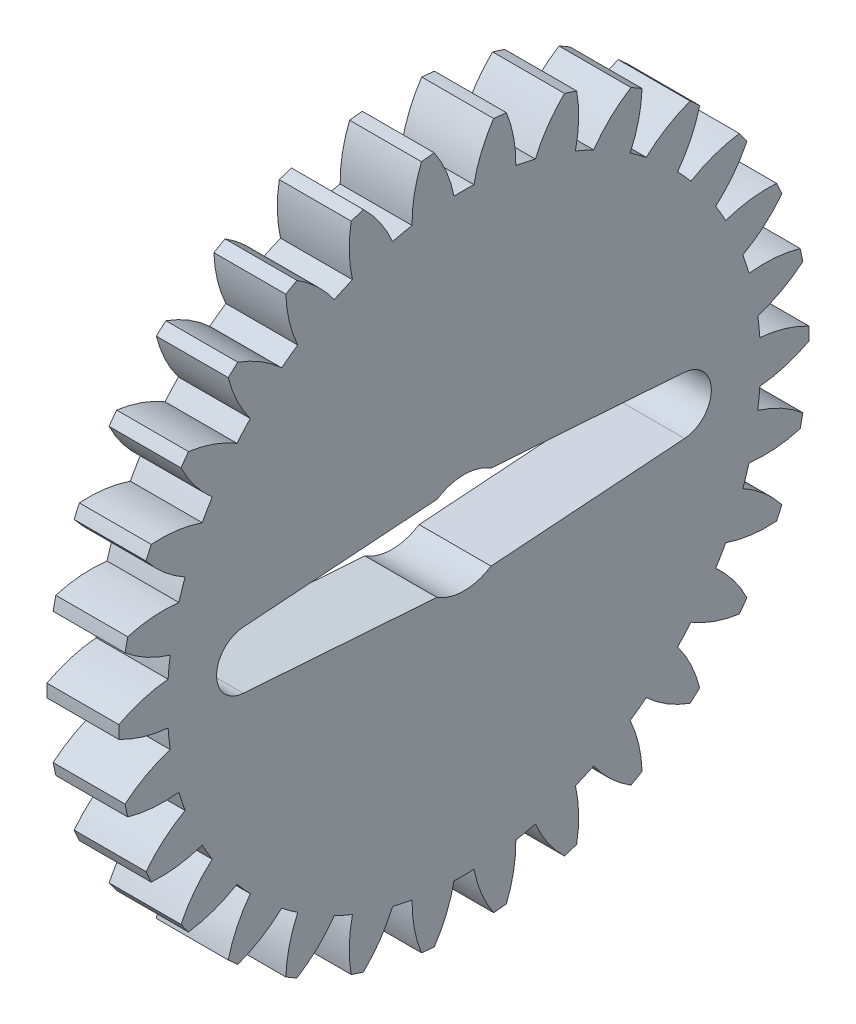
from build123d import *

# Parameters (mm, degrees)
BASPROSKE_W        = 5
BASPROSKE_H        = 24
TOOTHCUT_DEPTH     = 35.307433597
TEETHCUTS_COUNT    = 30
TEETHCUTS_ANGLE    = 348
BORSKE_R           = 2
BORE_DEPTH         = 50.000508
CUT_EXTRUDE1_DEPTH = 35.245275769


with BuildPart() as part:
    # BasProSke → Base-Revolve (revolve)
    with BuildSketch(Plane(origin=(0, 0, 0), x_dir=(1, 0, 0), z_dir=(0, 1, 0))):
        with Locations((2.5, 12)):
            Rectangle(BASPROSKE_W, BASPROSKE_H)
    revolve(axis=Axis((-10, 0, 0), (1, 0, 0)))

    # TooCutSke → ToothCut (cut, through all)
    with BuildSketch(Plane(origin=(0, 0, 0), x_dir=(0, 0, -1), z_dir=(1, 0, 0))):
        with BuildLine():
            ThreePointArc((0.693278797, 20.612344372), (0, 20.624), (-0.693278797, 20.612344372))
            ThreePointArc((-0.693278797, 20.612344372), (-1.270739341, 22.465148834), (-2.231973449, 24.151083009))
            ThreePointArc((-2.231973449, 24.151083009), (0, 24.254), (2.231973449, 24.151083009))
            ThreePointArc((2.231973449, 24.151083009), (1.270739341, 22.465148834), (0.693278797, 20.612344372))
        make_face()
    toothcut = extrude(amount=TOOTHCUT_DEPTH, mode=Mode.SUBTRACT)

    # TeethCuts: ToothCut ×30 about axis
    teethcuts_axis = Axis((-10, 0, 0), (1, 0, 0))
    for i in range(1, TEETHCUTS_COUNT):
        add(toothcut.rotate(teethcuts_axis, i * TEETHCUTS_ANGLE / (TEETHCUTS_COUNT - 1)), mode=Mode.SUBTRACT)

    # BorSke → Bore (cut, symmetric)
    with BuildSketch(Plane(origin=(0, 0, 0), x_dir=(0, 0, -1), z_dir=(1, 0, 0))):
        Circle(BORSKE_R)
    extrude(amount=BORE_DEPTH, both=True, mode=Mode.SUBTRACT)

    # Sketch2 → Cut-Extrude1 (cut, through all)
    with BuildSketch(Plane.ZY):
        with BuildLine():
            Line((-1.88348082, 2.95), (-15.34156858, 1.994983292))
            ThreePointArc((-15.34156858, 1.994983292), (-17.2, 0), (-15.34156858, -1.994983292))
            Line((-15.34156858, -1.994983292), (-1.88348082, -2.95))
            ThreePointArc((-1.88348082, -2.95), (0, -3.5), (1.88348082, -2.95))
            Line((1.88348082, -2.95), (15.34156858, -1.994983292))
            ThreePointArc((15.34156858, -1.994983292), (17.2, 0), (15.34156858, 1.994983292))
            Line((15.34156858, 1.994983292), (1.88348082, 2.95))
            ThreePointArc((1.88348082, 2.95), (0, 3.5), (-1.88348082, 2.95))
        make_face()
    extrude(amount=-CUT_EXTRUDE1_DEPTH, mode=Mode.SUBTRACT)


solid = part.part
